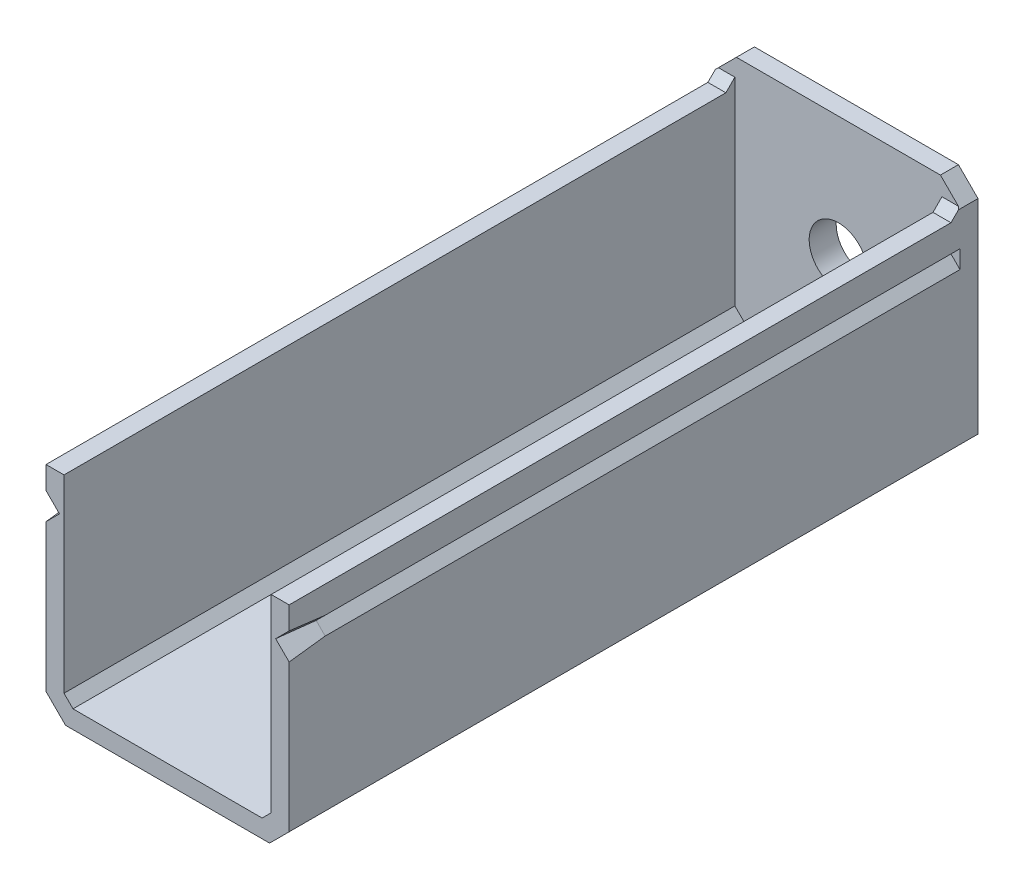
from build123d import *
from OCP.BRepFilletAPI import BRepFilletAPI_MakeChamfer

# Parameters (mm, degrees)
SKETCH1_W           = 27
SKETCH1_H           = 76.5
BOSS_EXTRUDE1_DEPTH = 27
CUT_EXTRUDE3_DEPTH  = 84.171509545
CUT_EXTRUDE4_DEPTH  = 84.171509545
CUT_EXTRUDE5_DEPTH  = 74.5
CHAMFER1_SIZE       = 4
CHAMFER1_SIZE2      = 0.349954654
CHAMFER2_SIZE       = 4
CHAMFER2_SIZE2      = 0.349954654
CHAMFER3_SIZE       = 1


# Read off the part's stored shape, not the designer's step: Boss-Extrude2
with BuildPart() as part:
    # Sketch1 → Boss-Extrude1 (new body)
    with BuildSketch(Plane(origin=(0, 0, 0), x_dir=(1, 0, 0), z_dir=(0, 1, 0))):
        Rectangle(SKETCH1_W, SKETCH1_H)
    extrude(amount=BOSS_EXTRUDE1_DEPTH)

    # Boss-Extrude2 outline → Boss-Extrude2 (revolve)
    with BuildSketch(Plane.XZ.offset(-13.5)):
        Polygon((0, -38.25), (0, -39.25), (4.75, -39.25), (5.75, -38.25), align=None)
    revolve(axis=Axis((0, 13.5, 0), (0, 0, 1)))

    # Sketch6 → Cut-Extrude3 (cut, through all)
    with BuildSketch(Plane(origin=(0, 0, -39.25), x_dir=(-1, 0, 0), z_dir=(0, 0, -1))):
        with BuildLine():
            ThreePointArc((3.25, 13.5), (-1.656175974, 16.296351399), (-1.562049935, 10.65))
            Line((-1.562049935, 10.65), (1.562049935, 10.65))
            ThreePointArc((1.562049935, 10.65), (2.796351399, 11.843824026), (3.25, 13.5))
        make_face()
    extrude(amount=-CUT_EXTRUDE3_DEPTH, mode=Mode.SUBTRACT)

    # Sketch7 → Cut-Extrude4 (cut, through all)
    with BuildSketch(Plane.XY.offset(38.25)):
        Polygon((-11.328427125, 0), (-13.5, 2.171572875), (-13.5, 0), align=None)
        Polygon((-13.5, 27), (-13.5, 24.828427125), (-11.328427125, 27), align=None)
        Polygon((13.5, 27), (11.328427125, 27), (13.5, 24.828427125), align=None)
        Polygon((13.5, 2.171572875), (11.328427125, 0), (13.5, 0), align=None)
    extrude(amount=-CUT_EXTRUDE4_DEPTH, mode=Mode.SUBTRACT)

    # Sketch7<3> → Cut-Extrude5 (cut)
    with BuildSketch(Plane.XY.offset(38.25)):
        Polygon((-13.5, 2.171572875), (-11.328427125, 0), (-13.5, 0), align=None)
        Polygon((-11.5, 24), (-13.5, 24), (-13.5, 27), (13.5, 27), (13.5, 24), (11.5, 24), (11.5, 3), (10.5, 2), (-10.5, 2), (-11.5, 3), align=None)
        Polygon((11.328427125, 0), (13.5, 0), (13.5, 2.171572875), align=None)
        Polygon((-13.5, 21), (-13.5, 19), (-12.5, 20), align=None)
        Polygon((13.5, 19), (12.5, 20), (13.5, 21), align=None)
    extrude(amount=-CUT_EXTRUDE5_DEPTH, mode=Mode.SUBTRACT)

    # Chamfer1: one chamfer whose edges measure the first distance from different faces: ONE call of the kernel's chamfer builder (chamfer() names one face for all edges)
    chamfer1_edges_1 = [part.edges().sort_by_distance(p)[0] for p in [
        (-13, 19.5, 38.25),
    ]]
    chamfer1_side_1 = [part.faces().sort_by_distance(p)[0] for p in [
        (-13, 19.5, 1),
    ]]
    chamfer1_edges_2 = [part.edges().sort_by_distance(p)[0] for p in [
        (-13, 20.5, 38.25),
    ]]
    chamfer1_side_2 = [part.faces().sort_by_distance(p)[0] for p in [
        (-13, 20.5, 1),
    ]]
    chamfer1 = BRepFilletAPI_MakeChamfer(part.part.solid().wrapped)
    for e in chamfer1_edges_1:
        chamfer1.Add(CHAMFER1_SIZE, CHAMFER1_SIZE2, e.wrapped, chamfer1_side_1[0].wrapped)  # the first distance lies on this face
    for e in chamfer1_edges_2:
        chamfer1.Add(CHAMFER1_SIZE, CHAMFER1_SIZE2, e.wrapped, chamfer1_side_2[0].wrapped)  # the first distance lies on this face
    add(Compound.cast(chamfer1.Shape()), mode=Mode.REPLACE)

    # Chamfer2: one chamfer whose edges measure the first distance from different faces: ONE call of the kernel's chamfer builder (chamfer() names one face for all edges)
    chamfer2_edges_1 = [part.edges().sort_by_distance(p)[0] for p in [
        (13, 19.5, 38.25),
    ]]
    chamfer2_side_1 = [part.faces().sort_by_distance(p)[0] for p in [
        (13, 19.5, 1),
    ]]
    chamfer2_edges_2 = [part.edges().sort_by_distance(p)[0] for p in [
        (13, 20.5, 38.25),
    ]]
    chamfer2_side_2 = [part.faces().sort_by_distance(p)[0] for p in [
        (13, 20.5, 1),
    ]]
    chamfer2 = BRepFilletAPI_MakeChamfer(part.part.solid().wrapped)
    for e in chamfer2_edges_1:
        chamfer2.Add(CHAMFER2_SIZE, CHAMFER2_SIZE2, e.wrapped, chamfer2_side_1[0].wrapped)  # the first distance lies on this face
    for e in chamfer2_edges_2:
        chamfer2.Add(CHAMFER2_SIZE, CHAMFER2_SIZE2, e.wrapped, chamfer2_side_2[0].wrapped)  # the first distance lies on this face
    add(Compound.cast(chamfer2.Shape()), mode=Mode.REPLACE)

    # Chamfer3
    chamfer3_edges = [part.edges().sort_by_distance(p)[0] for p in [
        (12.5, 24, -36.25),
        (-12.5, 24, -36.25),
    ]]
    chamfer(chamfer3_edges, length=CHAMFER3_SIZE)


solid = part.part
